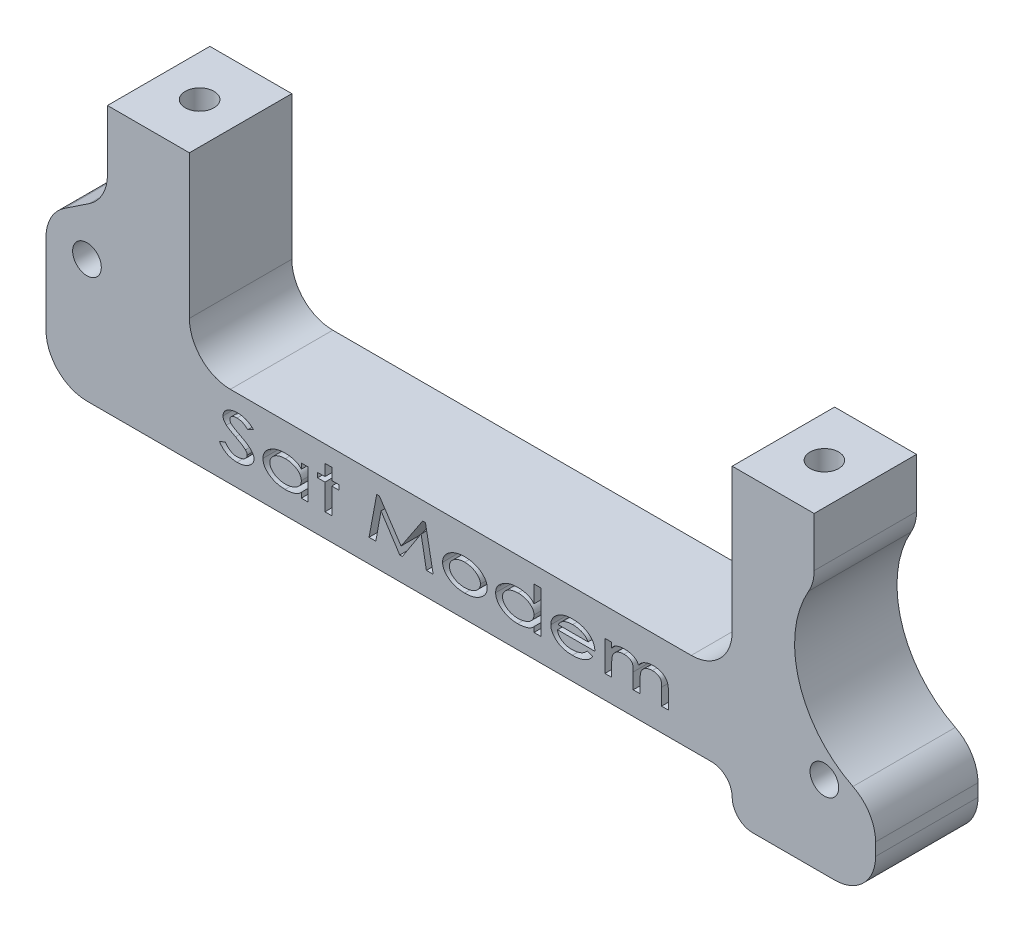
from build123d import *

# Parameters (mm, degrees)
SKETCH1_R           = 0.889
BOSS_EXTRUDE1_DEPTH = 6.35
SKETCH2_R           = 0.889
CUT_EXTRUDE1_DEPTH  = 5.08
SKETCH3_R           = 0.889
BOSS_EXTRUDE2_DEPTH = 6.35
SKETCH4_R           = 0.889
CUT_EXTRUDE2_DEPTH  = 5.08
FILLET1_R           = 2.54
CUT_EXTRUDE3_DEPTH  = 1.27
FILLET3_R           = 1.27


with BuildPart() as part:
    # Sketch1 → Boss-Extrude1 (new body)
    with BuildSketch(Plane.XY):
        Polygon((0, 0), (-2.54, 0), (-2.54, 6.35), (1.27, 8.89), (1.27, 13.97), (3.81, 13.97), (6.35, 13.97), (6.35, 8.89), (2.54, 6.35), (2.54, 0), align=None)
        with Locations((0, 5.08)):
            Circle(SKETCH1_R, mode=Mode.SUBTRACT)
    extrude(amount=BOSS_EXTRUDE1_DEPTH)

    # Sketch2 → Cut-Extrude1 (cut)
    with BuildSketch(Plane(origin=(0, 13.97, 0), x_dir=(1, 0, 0), z_dir=(0, 1, 0))):
        with Locations(Location((3.81, -3.175, 0), (0, 0, 270))):
            Circle(SKETCH2_R)
    extrude(amount=-CUT_EXTRUDE1_DEPTH, mode=Mode.SUBTRACT)


with BuildPart() as body_2:
    # Sketch3 → Boss-Extrude2 (new body)
    with BuildSketch(Plane.XY.offset(6.35)):
        with BuildLine():
            Line((45.085, 13.97), (42.545, 13.97))
            Line((42.545, 13.97), (40.005, 13.97))
            Line((40.005, 13.97), (40.005, 5.08))
            Line((40.005, 5.08), (40.005, 2.54))
            Line((40.005, 2.54), (6.35, 2.54))
            Line((6.35, 2.54), (6.35, 5.08))
            Line((6.35, 5.08), (6.35, 8.89))
            Line((6.35, 8.89), (2.54, 6.35))
            Line((2.54, 6.35), (2.54, 5.08))
            Line((2.54, 5.08), (2.54, 0))
            Line((2.54, 0), (-2.54, 0))
            Line((-2.54, 0), (-2.54, -2.54))
            Line((-2.54, -2.54), (6.35, -2.54))
            Line((6.35, -2.54), (40.005, -2.54))
            Line((40.005, -2.54), (40.005, -5.08))
            Line((40.005, -5.08), (48.895, -5.08))
            Line((48.895, -5.08), (48.895, 0))
            ThreePointArc((48.895, 0), (44.289046529, 4.067142448), (45.085, 10.16))
            Line((45.085, 10.16), (45.085, 13.97))
        make_face()
        with Locations((45.72, 0)):
            Circle(SKETCH3_R, mode=Mode.SUBTRACT)
    extrude(amount=-BOSS_EXTRUDE2_DEPTH)

    # Sketch4 → Cut-Extrude2 (cut)
    with BuildSketch(Plane(origin=(0, 13.97, 0), x_dir=(1, 0, 0), z_dir=(0, 1, 0))):
        with Locations(Location((42.545, -3.175, 0), (0, 0, 270))):
            Circle(SKETCH4_R)
    extrude(amount=-CUT_EXTRUDE2_DEPTH, mode=Mode.SUBTRACT)

    # Combine1: union part
    add(part.part)

    # Fillet1
    fillet1_edges = [body_2.edges().sort_by_distance(p)[0] for p in [
        (48.895, 0, 3.175),
        (48.895, -5.08, 3.175),
        (-2.54, -2.54, 3.175),
        (6.35, 2.54, 3.175),
        (40.005, 2.54, 3.175),
        (45.085, 10.16, 3.175),
        (1.27, 8.89, 3.175),
        (-2.54, 6.35, 3.175),
    ]]
    fillet(fillet1_edges, radius=FILLET1_R)

    # Sketch5 → Cut-Extrude3 (cut)
    # profile 1 of 8: a face of its own
    with BuildSketch(Plane.XY.offset(6.35)):
        with BuildLine():
            Line((8.209416158, -0.599815641), (8.567621286, -0.454294808))
            add(Edge.make_bspline(
                [(8.567621286, -0.454294808), (8.595567039, -0.487859205), (8.649616222, -0.552775268), (8.737047903, -0.639050416), (8.825692977, -0.712499887), (8.91612665, -0.772659085), (9.008141072, -0.819479637), (9.101742109, -0.853045199), (9.197129605, -0.873800405), (9.261543052, -0.876353571), (9.29369901, -0.877628141)],
                knots=[0, 0, 0, 0, 1.204403746, 2.329407229, 3.383292808, 4.376124273, 5.319920516, 6.224240073, 7.113519548, 8, 8, 8, 8], degree=3))
            add(Edge.make_bspline(
                [(9.29369901, -0.877628141), (9.322900058, -0.876940352), (9.380652933, -0.875580065), (9.465720726, -0.86488052), (9.547497432, -0.846248799), (9.625272418, -0.821774186), (9.696850751, -0.791341472), (9.759887128, -0.755716859), (9.81397442, -0.715901882), (9.857653154, -0.671039212), (9.892200407, -0.62354309), (9.917036201, -0.574478513), (9.932096917, -0.524026728), (9.934246575, -0.490007131), (9.935313594, -0.47312093)],
                knots=[0, 0, 0, 0, 1.261425992, 2.494806987, 3.696567175, 4.88079595, 6.013291718, 7.050351036, 8.00296582, 8.904613568, 9.744534866, 10.531037541, 11.270855683, 12, 12, 12, 12], degree=3))
            add(Edge.make_bspline(
                [(9.935313594, -0.47312093), (9.933882054, -0.453761952), (9.93093488, -0.413906753), (9.907528312, -0.355310371), (9.871325091, -0.29695813), (9.838643301, -0.261768729), (9.821339235, -0.243136955)],
                knots=[0, 0, 0, 0, 0.881099276, 1.813958736, 2.842554116, 4, 4, 4, 4], degree=3))
            add(Edge.make_bspline(
                [(9.821339235, -0.243136955), (9.806270012, -0.229004546), (9.774287548, -0.199010347), (9.71903107, -0.155986491), (9.655470909, -0.110551675), (9.583770125, -0.061870926), (9.502619723, -0.012400366), (9.412813335, 0.039565892), (9.314403385, 0.093820793), (9.245431177, 0.12995429), (9.209744683, 0.148649904)],
                knots=[0, 0, 0, 0, 0.680316442, 1.443883074, 2.30454259, 3.254539655, 4.298172233, 5.43481373, 6.672762469, 8, 8, 8, 8], degree=3))
            add(Edge.make_bspline(
                [(9.209744683, 0.148649904), (9.173380557, 0.167517035), (9.104142012, 0.203440699), (9.006315461, 0.256748467), (8.918663973, 0.304969669), (8.84248106, 0.350754779), (8.775922751, 0.39092624), (8.720804631, 0.428055236), (8.675592869, 0.460333326), (8.650588061, 0.482258018), (8.639364074, 0.492099423)],
                knots=[0, 0, 0, 0, 1.473809098, 2.806183083, 4.008098438, 5.072351146, 6.003750605, 6.804226864, 7.463249592, 8, 8, 8, 8], degree=3))
            add(Edge.make_bspline(
                [(8.639364074, 0.492099423), (8.623335961, 0.507281097), (8.592115721, 0.536852604), (8.550742408, 0.58425197), (8.515920592, 0.632875962), (8.487067297, 0.682290551), (8.464922579, 0.733215903), (8.449303096, 0.78514265), (8.43896059, 0.838023947), (8.437897512, 0.873662444), (8.437364876, 0.891518494)],
                knots=[0, 0, 0, 0, 1.147998132, 2.236119427, 3.266892629, 4.255099878, 5.207404002, 6.147987646, 7.072081361, 8, 8, 8, 8], degree=3))
            add(Edge.make_bspline(
                [(8.437364876, 0.891518494), (8.437829104, 0.905779173), (8.438743869, 0.933879938), (8.443840979, 0.975644321), (8.452821219, 1.016291467), (8.466599927, 1.055680027), (8.482517091, 1.094381562), (8.502770692, 1.131945599), (8.526538639, 1.168420825), (8.563898141, 1.215777825), (8.618187984, 1.271524775), (8.695253481, 1.329643611), (8.782725927, 1.38086547), (8.880968074, 1.422709622), (8.986272192, 1.457256184), (9.097445724, 1.481434733), (9.212547308, 1.496603889), (9.290768325, 1.498561273), (9.330333626, 1.499551346)],
                knots=[0, 0, 0, 0, 0.57284708, 1.128799077, 1.687373995, 2.240984074, 2.802706851, 3.366491003, 3.952194653, 4.549042111, 5.787026847, 7.064996091, 8.414386474, 9.84820421, 11.345348371, 12.859259147, 14.411368701, 16, 16, 16, 16], degree=3))
            add(Edge.make_bspline(
                [(9.330333626, 1.499551346), (9.374142679, 1.498655163), (9.460527006, 1.496888036), (9.587825197, 1.480421599), (9.710821863, 1.45474975), (9.81041113, 1.424139041), (9.888586912, 1.392931176), (9.948399546, 1.364742284), (10.009161573, 1.331708286), (10.071013933, 1.293887902), (10.13344473, 1.250954826), (10.19722283, 1.203597295), (10.261755051, 1.151141586), (10.304329598, 1.113677424), (10.326082824, 1.09453532)],
                knots=[0, 0, 0, 0, 1.428510824, 2.816790956, 4.179702888, 5.523684412, 6.208959093, 6.924242334, 7.679310206, 8.464038766, 9.288115338, 10.150117837, 11.054813087, 12, 12, 12, 12], degree=3))
            Line((10.326082824, 1.09453532), (9.978562792, 0.9133975))
            add(Edge.make_bspline(
                [(9.978562792, 0.9133975), (9.960343059, 0.928109095), (9.924967015, 0.95667362), (9.872097938, 0.996012998), (9.82226012, 1.031945601), (9.774750431, 1.063421968), (9.73039487, 1.091543665), (9.688185343, 1.115139163), (9.648863581, 1.135000999), (9.599682098, 1.156148566), (9.538309955, 1.176853458), (9.462429295, 1.193978284), (9.383370309, 1.204406439), (9.329687308, 1.205776639), (9.30234885, 1.206474423)],
                knots=[0, 0, 0, 0, 1.117257755, 2.169305093, 3.143926228, 4.048461068, 4.888268315, 5.649151633, 6.354886442, 6.989271394, 8.202308643, 9.439111444, 10.695848923, 12, 12, 12, 12], degree=3))
            add(Edge.make_bspline(
                [(9.30234885, 1.206474423), (9.271233936, 1.205618277), (9.21164713, 1.203978709), (9.126820037, 1.188265319), (9.050324381, 1.164018184), (8.994285554, 1.133567188), (8.955023576, 1.105673148), (8.929799145, 1.083243661), (8.908923126, 1.05908848), (8.891121888, 1.033885577), (8.877469426, 1.006972312), (8.867498844, 0.978431382), (8.861999976, 0.94837837), (8.861134784, 0.927834454), (8.860698209, 0.917468013)],
                knots=[0, 0, 0, 0, 1.910046694, 3.657846604, 5.282621723, 6.821391664, 7.55315207, 8.23949341, 8.889503724, 9.511069909, 10.130973799, 10.737415314, 11.362900893, 12, 12, 12, 12], degree=3))
            add(Edge.make_bspline(
                [(8.860698209, 0.917468013), (8.861320924, 0.90402447), (8.862563421, 0.877200714), (8.87150514, 0.837753995), (8.886120364, 0.799522124), (8.9061937, 0.761911779), (8.933163486, 0.724553622), (8.968443354, 0.68850388), (9.009656247, 0.650659175), (9.041396708, 0.627789404), (9.058118081, 0.61574125)],
                knots=[0, 0, 0, 0, 0.85853488, 1.713025381, 2.570396888, 3.467262073, 4.429683605, 5.502862464, 6.684468789, 8, 8, 8, 8], degree=3))
            add(Edge.make_bspline(
                [(9.058118081, 0.61574125), (9.066374102, 0.610225938), (9.085759614, 0.597275736), (9.120534124, 0.577572976), (9.163654085, 0.552296711), (9.216294463, 0.523523402), (9.277748279, 0.49005172), (9.348040413, 0.451566386), (9.427778304, 0.40969146), (9.483990074, 0.380319188), (9.513506703, 0.364895897)],
                knots=[0, 0, 0, 0, 0.458069209, 1.075567279, 1.843501004, 2.764907121, 3.843713047, 5.073065989, 6.463075867, 8, 8, 8, 8], degree=3))
            add(Edge.make_bspline(
                [(9.513506703, 0.364895897), (9.552425631, 0.344353068), (9.62760611, 0.304670071), (9.735069429, 0.244856018), (9.832697132, 0.186310797), (9.921058758, 0.130058672), (9.999392365, 0.075096212), (10.068523965, 0.022389105), (10.127705556, -0.029077492), (10.178267657, -0.078806915), (10.221102884, -0.127648548), (10.257394645, -0.176327151), (10.288461484, -0.224533741), (10.314589409, -0.272559086), (10.333548797, -0.321123692), (10.348399971, -0.369111817), (10.35657372, -0.41738299), (10.357958685, -0.449519071), (10.358646927, -0.465488718)],
                knots=[0, 0, 0, 0, 1.705047532, 3.29367472, 4.764359135, 6.115067738, 7.351092649, 8.470927793, 9.481641474, 10.387736264, 11.216704684, 11.996056616, 12.737939354, 13.437585149, 14.109943664, 14.754462843, 15.381044999, 16, 16, 16, 16], degree=3))
            add(Edge.make_bspline(
                [(10.358646927, -0.465488718), (10.35787293, -0.488472918), (10.356331391, -0.534249673), (10.340561179, -0.601465016), (10.316671854, -0.666789084), (10.282490712, -0.729803646), (10.238935864, -0.790660461), (10.185147156, -0.848843153), (10.122307789, -0.905386184), (10.050710607, -0.959029931), (9.972442745, -1.008689044), (9.888767894, -1.051902062), (9.800960382, -1.088625633), (9.708920178, -1.118762962), (9.612599964, -1.142018591), (9.512136269, -1.158892942), (9.407351322, -1.168476749), (9.336119235, -1.169952645), (9.29980478, -1.170705064)],
                knots=[0, 0, 0, 0, 0.788129436, 1.56968741, 2.358505394, 3.171618619, 4.02347347, 4.922347341, 5.887446626, 6.923145908, 7.991358753, 9.067357325, 10.153509495, 11.256909772, 12.389986101, 13.553512878, 14.752769255, 16, 16, 16, 16], degree=3))
            add(Edge.make_bspline(
                [(9.29980478, -1.170705064), (9.272828684, -1.170277076), (9.219497335, -1.16943095), (9.140509045, -1.163817655), (9.063384114, -1.154186916), (8.988195924, -1.140327599), (8.914717709, -1.123231698), (8.843458664, -1.10167689), (8.773918912, -1.076724564), (8.705922394, -1.047746172), (8.639366734, -1.013622728), (8.574313323, -0.972955665), (8.510533437, -0.926177222), (8.447514978, -0.873462912), (8.385915541, -0.814207784), (8.325682663, -0.748588486), (8.266195261, -0.676948734), (8.228663891, -0.62596324), (8.209416158, -0.599815641)],
                knots=[0, 0, 0, 0, 1.006227997, 1.989298091, 2.952128759, 3.903900811, 4.839962792, 5.764667717, 6.679210144, 7.594649299, 8.519895108, 9.466121111, 10.453132521, 11.468093358, 12.528547425, 13.63887556, 14.789111772, 16, 16, 16, 16], degree=3))
        make_face()
    # profile 2 of 8: a face of its own
    with BuildSketch(Plane.XY.offset(6.35)):
        with BuildLine():
            Line((13.712749491, 0.78314109), (13.712749491, -1.105576859))
            Line((13.712749491, -1.105576859), (13.289416158, -1.105576859))
            Line((13.289416158, -1.105576859), (13.289416158, -0.79062093))
            add(Edge.make_bspline(
                [(13.289416158, -0.79062093), (13.277775924, -0.804567439), (13.254140815, -0.832885364), (13.213847629, -0.872012593), (13.168781548, -0.90805885), (13.119473295, -0.941911514), (13.065798316, -0.97332508), (13.007485325, -1.00168046), (12.945041046, -1.027885399), (12.85529008, -1.058708587), (12.737046473, -1.091153832), (12.589289765, -1.118307695), (12.435498641, -1.134939398), (12.331022248, -1.137061716), (12.277893722, -1.138140962)],
                knots=[0, 0, 0, 0, 0.59286657, 1.203795929, 1.829971431, 2.475131726, 3.155190389, 3.858570061, 4.590852341, 5.364971803, 6.955662865, 8.589261133, 10.26556482, 12, 12, 12, 12], degree=3))
            add(Edge.make_bspline(
                [(12.277893722, -1.138140962), (12.231725872, -1.137270825), (12.14106234, -1.135562069), (12.007636114, -1.121810936), (11.879036998, -1.100571939), (11.755774071, -1.068460884), (11.637097687, -1.029133201), (11.523893552, -0.979930342), (11.415487013, -0.922381306), (11.313596041, -0.856207566), (11.220258912, -0.78392543), (11.137862656, -0.706760644), (11.068144874, -0.62516241), (11.011142964, -0.539249107), (10.966833864, -0.449284689), (10.934968553, -0.355290745), (10.915563576, -0.256995194), (10.913352784, -0.189968191), (10.912236671, -0.156129744)],
                knots=[0, 0, 0, 0, 1.190889276, 2.338645406, 3.457304184, 4.550467384, 5.621511307, 6.679894181, 7.731133741, 8.784665885, 9.810535541, 10.773237904, 11.6921299, 12.573246784, 13.426497455, 14.271992985, 15.127619154, 16, 16, 16, 16], degree=3))
            add(Edge.make_bspline(
                [(10.912236671, -0.156129744), (10.913291142, -0.122955064), (10.915380834, -0.057211384), (10.935735629, 0.039071083), (10.967345231, 0.131702151), (11.012094621, 0.220339896), (11.069891416, 0.30485223), (11.140104608, 0.385552093), (11.22336654, 0.462017848), (11.317843632, 0.533747851), (11.420581234, 0.599964956), (11.529999291, 0.657561003), (11.644219071, 0.706406211), (11.763213061, 0.746864246), (11.887286745, 0.777909431), (12.016436266, 0.799479815), (12.150399873, 0.813066318), (12.241395929, 0.81481701), (12.28756119, 0.815705192)],
                knots=[0, 0, 0, 0, 0.855543435, 1.69546699, 2.529157261, 3.377147248, 4.250438295, 5.166218617, 6.133042243, 7.163931696, 8.225603736, 9.285359399, 10.352571269, 11.42995896, 12.527100696, 13.650905647, 14.808227978, 16, 16, 16, 16], degree=3))
            add(Edge.make_bspline(
                [(12.28756119, 0.815705192), (12.342046986, 0.814480257), (12.448924253, 0.812077471), (12.605572369, 0.794766414), (12.754650572, 0.765211363), (12.873043904, 0.731085475), (12.9619788, 0.697638377), (13.023769402, 0.670469929), (13.080370889, 0.639657705), (13.132379187, 0.606936088), (13.179183353, 0.570944261), (13.2209275, 0.532309221), (13.258031588, 0.490961404), (13.279012136, 0.461109422), (13.289416158, 0.446306154)],
                knots=[0, 0, 0, 0, 1.771002469, 3.473931111, 5.115262809, 6.706398851, 7.472349499, 8.202876104, 8.898534536, 9.565369253, 10.198342074, 10.814746699, 11.412245988, 12, 12, 12, 12], degree=3))
            Line((13.289416158, 0.446306154), (13.289416158, 0.78314109))
            Line((13.289416158, 0.78314109), (13.712749491, 0.78314109))
        make_face()
        with BuildLine():
            add(Edge.make_bspline(
                [(12.297228658, 0.522628269), (12.254772046, 0.521561419), (12.171236132, 0.519462327), (12.048443642, 0.502610049), (11.930559133, 0.476036113), (11.818822987, 0.438008664), (11.715261233, 0.389928784), (11.620984441, 0.332914112), (11.537929931, 0.265703055), (11.477725716, 0.20226985), (11.436107484, 0.148161908), (11.409759297, 0.10651582), (11.386152958, 0.064808694), (11.368352983, 0.021325772), (11.353108107, -0.022330867), (11.343090154, -0.067066036), (11.336708413, -0.112524421), (11.335951263, -0.143218144), (11.335570004, -0.158673814)],
                knots=[0, 0, 0, 0, 1.564934391, 3.079101678, 4.561238672, 6.014800545, 7.422102438, 8.763849877, 10.066734671, 11.349609611, 11.978750407, 12.580698229, 13.165643647, 13.742916877, 14.310488493, 14.868750469, 15.430364981, 16, 16, 16, 16], degree=3))
            add(Edge.make_bspline(
                [(11.335570004, -0.158673814), (11.335971052, -0.174124206), (11.336767501, -0.204807447), (11.342863428, -0.250382101), (11.35398652, -0.294807921), (11.367976532, -0.338944594), (11.387141436, -0.382189943), (11.409962584, -0.424970323), (11.437095996, -0.466784406), (11.478815286, -0.521380258), (11.539444282, -0.584917231), (11.622678614, -0.652898448), (11.717139551, -0.710913615), (11.821233059, -0.759308038), (11.932773137, -0.797783897), (12.04972682, -0.825146125), (12.171069054, -0.841842396), (12.25341738, -0.843979744), (12.295193401, -0.845064038)],
                knots=[0, 0, 0, 0, 0.569555588, 1.131091788, 1.690709988, 2.256235529, 2.835895415, 3.431752916, 4.042259523, 4.671312591, 5.96284812, 7.269491954, 8.622933924, 10.038350804, 11.493739645, 12.964906207, 14.460270517, 16, 16, 16, 16], degree=3))
            add(Edge.make_bspline(
                [(12.295193401, -0.845064038), (12.339181748, -0.844062241), (12.426318464, -0.842077775), (12.555035693, -0.823975957), (12.680176619, -0.79582841), (12.780657543, -0.762212484), (12.857550913, -0.730298377), (12.911760059, -0.704539975), (12.962559863, -0.676869501), (13.009920863, -0.647488373), (13.053802154, -0.615892629), (13.094170596, -0.582289647), (13.130753926, -0.546596106), (13.164153439, -0.50937582), (13.1933688, -0.470409581), (13.219110145, -0.430317301), (13.241335185, -0.389215031), (13.258259462, -0.346306057), (13.272259057, -0.302670909), (13.282626768, -0.257968745), (13.288093613, -0.211897146), (13.288973036, -0.180904757), (13.289416158, -0.165288397)],
                knots=[0, 0, 0, 0, 1.979914931, 3.922022504, 5.841486324, 7.749504567, 8.68422631, 9.589528547, 10.4508153, 11.287922678, 12.097649616, 12.883874706, 13.650833179, 14.397364529, 15.133628248, 15.841248553, 16.541660313, 17.233777927, 17.914936497, 18.604182592, 19.296679368, 20, 20, 20, 20], degree=3))
            add(Edge.make_bspline(
                [(13.289416158, -0.165288397), (13.288515809, -0.141484341), (13.286739435, -0.094519294), (13.273207482, -0.02562085), (13.250448424, 0.040124547), (13.219134307, 0.103315282), (13.178703846, 0.163453922), (13.129091365, 0.220431407), (13.070647849, 0.274291099), (13.004427174, 0.32521078), (12.931716158, 0.371821718), (12.853511178, 0.411906903), (12.771329333, 0.446100459), (12.684897081, 0.474171582), (12.594037391, 0.495969978), (12.49883524, 0.511713989), (12.399344189, 0.520920095), (12.331677641, 0.522052011), (12.297228658, 0.522628269)],
                knots=[0, 0, 0, 0, 0.854754496, 1.686417822, 2.51108849, 3.347603022, 4.21280385, 5.106953924, 6.055399562, 7.063239889, 8.104380145, 9.153512213, 10.21600508, 11.29884717, 12.414564085, 13.569469511, 14.762618932, 16, 16, 16, 16], degree=3))
        make_face(mode=Mode.SUBTRACT)
    # profile 3 of 8: a face of its own
    with BuildSketch(Plane.XY.offset(6.35)):
        Polygon((14.754800773, 1.499551346), (15.178134106, 1.499551346), (15.178134106, 0.78314109), (15.634031542, 0.78314109), (15.634031542, 0.490064167), (15.178134106, 0.490064167), (15.178134106, -1.105576859), (14.754800773, -1.105576859), (14.754800773, 0.490064167), (14.298903337, 0.490064167), (14.298903337, 0.78314109), (14.754800773, 0.78314109), align=None)
    # profile 4 of 8: a face of its own
    with BuildSketch(Plane.XY.offset(6.35)):
        Polygon((17.490185389, -1.105576859), (17.963891318, 1.434423141), (18.127220645, 1.434423141), (19.473033946, -0.584551218), (20.817320805, 1.434423141), (20.986247087, 1.434423141), (21.463005901, -1.105576859), (21.043234267, -1.105576859), (20.718610869, 0.685448782), (19.554953017, -1.105576859), (19.393658946, -1.105576859), (18.23203635, 0.685448782), (17.909448209, -1.105576859), align=None)
    # profile 5 of 8: a face of its own
    with BuildSketch(Plane.XY.offset(6.35)):
        with BuildLine():
            add(Edge.make_bspline(
                [(23.417869683, 0.815705192), (23.468622165, 0.814963688), (23.567978542, 0.813512072), (23.713312881, 0.798115252), (23.851827974, 0.774579528), (23.983288764, 0.741150739), (24.107765199, 0.697747946), (24.225165176, 0.64452693), (24.336351035, 0.582552135), (24.404259835, 0.532681475), (24.438041959, 0.50787266)],
                knots=[0, 0, 0, 0, 1.121843398, 2.196193992, 3.227693111, 4.226424636, 5.19188842, 6.138536693, 7.073990655, 8, 8, 8, 8], degree=3))
            add(Edge.make_bspline(
                [(24.438041959, 0.50787266), (24.468206945, 0.483492156), (24.526650438, 0.436255874), (24.603976078, 0.358267163), (24.669552166, 0.277714919), (24.723616845, 0.194506575), (24.765385702, 0.1081713), (24.794954697, 0.019073647), (24.813550213, -0.072765037), (24.815918075, -0.135012486), (24.817108465, -0.166306026)],
                knots=[0, 0, 0, 0, 1.159598527, 2.246677282, 3.27838877, 4.26215131, 5.208447336, 6.139038675, 7.064442529, 8, 8, 8, 8], degree=3))
            add(Edge.make_bspline(
                [(24.817108465, -0.166306026), (24.815958823, -0.197942804), (24.813676944, -0.260737363), (24.794585269, -0.353174519), (24.763779019, -0.442597708), (24.720482616, -0.529184819), (24.664924437, -0.613023471), (24.597307821, -0.694159681), (24.517282497, -0.772078488), (24.426302553, -0.846289774), (24.325601164, -0.914547825), (24.216987663, -0.974935157), (24.100947005, -1.025180063), (23.978007499, -1.066442088), (23.848095535, -1.099156399), (23.710897092, -1.121552594), (23.56674134, -1.135699121), (23.468276566, -1.137314172), (23.417869683, -1.138140962)],
                knots=[0, 0, 0, 0, 0.806509271, 1.600807569, 2.397224564, 3.213850418, 4.063545236, 4.957743496, 5.903236688, 6.908841922, 7.949375341, 9.00302485, 10.074620494, 11.170669618, 12.308295498, 13.488453241, 14.714268703, 16, 16, 16, 16], degree=3))
            add(Edge.make_bspline(
                [(23.417869683, -1.138140962), (23.368817649, -1.13732045), (23.272888098, -1.135715802), (23.132500129, -1.121451948), (22.998892302, -1.099579155), (22.871980952, -1.067819347), (22.751649812, -1.027396256), (22.638253553, -0.977139841), (22.531308979, -0.918785524), (22.432824032, -0.851149915), (22.343184195, -0.77821775), (22.264882511, -0.700723588), (22.198454635, -0.619864089), (22.144168703, -0.535509128), (22.101329969, -0.448024379), (22.071062879, -0.357026998), (22.052732007, -0.262699881), (22.050356956, -0.198611489), (22.049159748, -0.166306026)],
                knots=[0, 0, 0, 0, 1.266731681, 2.477308061, 3.641211968, 4.761146019, 5.852858088, 6.915996234, 7.961090173, 8.995180484, 9.99760397, 10.942455291, 11.836067435, 12.695252235, 13.527993871, 14.345381971, 15.165945634, 16, 16, 16, 16], degree=3))
            add(Edge.make_bspline(
                [(22.049159748, -0.166306026), (22.050165061, -0.134336992), (22.052158751, -0.070937557), (22.070278207, 0.022186204), (22.098648836, 0.112081395), (22.139566381, 0.198160186), (22.191401718, 0.281038319), (22.254471037, 0.360734524), (22.329101845, 0.437097351), (22.38583109, 0.482832549), (22.414997087, 0.506346218)],
                knots=[0, 0, 0, 0, 0.964658345, 1.913063596, 2.854262027, 3.805222979, 4.783118644, 5.800724498, 6.869294597, 8, 8, 8, 8], degree=3))
            add(Edge.make_bspline(
                [(22.414997087, 0.506346218), (22.448785757, 0.531309668), (22.51627251, 0.581169639), (22.626536723, 0.643536754), (22.742442147, 0.697302549), (22.865316853, 0.74019609), (22.994111403, 0.774875678), (23.12973613, 0.797960925), (23.27164624, 0.813531294), (23.368470727, 0.81497078), (23.417869683, 0.815705192)],
                knots=[0, 0, 0, 0, 0.942172848, 1.881819717, 2.837402235, 3.806657492, 4.799314022, 5.827624345, 6.891674054, 8, 8, 8, 8], degree=3))
        make_face()
        with BuildLine():
            add(Edge.make_bspline(
                [(23.416852055, 0.522628269), (23.385284302, 0.522052743), (23.32319949, 0.520920847), (23.231666601, 0.511651768), (23.143582513, 0.495889625), (23.058694519, 0.47395624), (22.977027897, 0.445905301), (22.898525913, 0.411834096), (22.823250481, 0.371407957), (22.752267835, 0.325101603), (22.687172423, 0.274271681), (22.6295501, 0.22039847), (22.581231125, 0.162975289), (22.541743931, 0.102421028), (22.510308718, 0.039210157), (22.488188958, -0.027207215), (22.475295395, -0.096606869), (22.473436066, -0.143864891), (22.472493081, -0.167832468)],
                knots=[0, 0, 0, 0, 1.170638753, 2.302314259, 3.407901618, 4.486586774, 5.55086912, 6.607314778, 7.657090948, 8.716155278, 9.74675862, 10.716799497, 11.636587967, 12.522921502, 13.392215507, 14.247582655, 15.111236652, 16, 16, 16, 16], degree=3))
            add(Edge.make_bspline(
                [(22.472493081, -0.167832468), (22.472861693, -0.183629394), (22.473593775, -0.215002941), (22.480156875, -0.261402047), (22.489408044, -0.30704462), (22.504141534, -0.35125318), (22.521681177, -0.39494693), (22.544469846, -0.437004162), (22.570392329, -0.478494588), (22.610566021, -0.532105205), (22.669412747, -0.594227269), (22.750173288, -0.660252435), (22.841958158, -0.716694832), (22.943702057, -0.762812795), (23.053224752, -0.800118233), (23.169695213, -0.825397392), (23.29134147, -0.842591379), (23.374558773, -0.844230827), (23.416852055, -0.845064038)],
                knots=[0, 0, 0, 0, 0.588214266, 1.168225258, 1.743292835, 2.320820124, 2.90169103, 3.495311169, 4.100159398, 4.72321826, 5.988368824, 7.277283096, 8.599519126, 9.990627284, 11.431382809, 12.901562039, 14.425290069, 16, 16, 16, 16], degree=3))
            add(Edge.make_bspline(
                [(23.416852055, -0.845064038), (23.460998498, -0.843980097), (23.547733257, -0.841850471), (23.674862674, -0.825352317), (23.796205122, -0.797885008), (23.910748285, -0.759647352), (24.016478762, -0.710918529), (24.111822572, -0.653796668), (24.194976109, -0.586775064), (24.254244838, -0.523586487), (24.29524259, -0.470072689), (24.321351285, -0.428893464), (24.343750637, -0.387292548), (24.362476932, -0.344904378), (24.375904102, -0.301412499), (24.386292652, -0.257602999), (24.392621366, -0.212961909), (24.393388713, -0.182947219), (24.393775132, -0.167832468)],
                knots=[0, 0, 0, 0, 1.612918919, 3.16891064, 4.675481193, 6.153308641, 7.573175975, 8.922075574, 10.2046402, 11.463076354, 12.077928185, 12.665953787, 13.242733267, 13.803471536, 14.356240496, 14.903491756, 15.447822069, 16, 16, 16, 16], degree=3))
            add(Edge.make_bspline(
                [(24.393775132, -0.167832468), (24.392868932, -0.144538691), (24.391081218, -0.098585685), (24.377560295, -0.030785843), (24.354128697, 0.033900354), (24.323101241, 0.096901076), (24.281697184, 0.156454189), (24.231794002, 0.213821535), (24.173122959, 0.268903083), (24.105639576, 0.319928306), (24.032862481, 0.367368863), (23.955407759, 0.408892525), (23.874337365, 0.443929056), (23.789688506, 0.473095725), (23.701507525, 0.495439069), (23.609795077, 0.511035962), (23.514599562, 0.521085631), (23.449781223, 0.522108586), (23.416852055, 0.522628269)],
                knots=[0, 0, 0, 0, 0.847343288, 1.671604043, 2.503156942, 3.344975613, 4.219723447, 5.134153846, 6.107814097, 7.142248072, 8.208735868, 9.266275212, 10.335990339, 11.419204486, 12.520897708, 13.642073847, 14.802120714, 16, 16, 16, 16], degree=3))
        make_face(mode=Mode.SUBTRACT)
    # profile 6 of 8: a face of its own
    with BuildSketch(Plane.XY.offset(6.35)):
        with BuildLine():
            Line((28.138646927, 1.499551346), (28.138646927, -1.105576859))
            Line((28.138646927, -1.105576859), (27.715313594, -1.105576859))
            Line((27.715313594, -1.105576859), (27.715313594, -0.79062093))
            add(Edge.make_bspline(
                [(27.715313594, -0.79062093), (27.70367336, -0.804567439), (27.680038251, -0.832885364), (27.639745065, -0.872012593), (27.594678984, -0.90805885), (27.545370731, -0.941911514), (27.491695752, -0.97332508), (27.433382761, -1.00168046), (27.370938482, -1.027885399), (27.281187515, -1.058708587), (27.162943909, -1.091153832), (27.015187201, -1.118307695), (26.861396076, -1.134939398), (26.756919684, -1.137061716), (26.703791158, -1.138140962)],
                knots=[0, 0, 0, 0, 0.59286657, 1.203795929, 1.829971431, 2.475131726, 3.155190389, 3.858570061, 4.590852341, 5.364971803, 6.955662865, 8.589261133, 10.26556482, 12, 12, 12, 12], degree=3))
            add(Edge.make_bspline(
                [(26.703791158, -1.138140962), (26.657623308, -1.137270825), (26.566959776, -1.135562069), (26.43353355, -1.121810936), (26.304934434, -1.100571939), (26.181671506, -1.068460884), (26.062995123, -1.029133201), (25.949790988, -0.979930342), (25.841384449, -0.922381306), (25.739493477, -0.856207566), (25.646156348, -0.78392543), (25.563760092, -0.706760644), (25.49404231, -0.62516241), (25.4370404, -0.539249107), (25.3927313, -0.449284689), (25.360865989, -0.355290745), (25.341461012, -0.256995194), (25.33925022, -0.189968191), (25.338134106, -0.156129744)],
                knots=[0, 0, 0, 0, 1.190889276, 2.338645406, 3.457304184, 4.550467384, 5.621511307, 6.679894181, 7.731133741, 8.784665885, 9.810535541, 10.773237904, 11.6921299, 12.573246784, 13.426497455, 14.271992985, 15.127619154, 16, 16, 16, 16], degree=3))
            add(Edge.make_bspline(
                [(25.338134106, -0.156129744), (25.339188578, -0.122955064), (25.34127827, -0.057211384), (25.361633065, 0.039071083), (25.393242667, 0.131702151), (25.437992057, 0.220339896), (25.495788852, 0.30485223), (25.566002044, 0.385552093), (25.649263976, 0.462017848), (25.743741068, 0.533747851), (25.84647867, 0.599964956), (25.955896727, 0.657561003), (26.070116507, 0.706406211), (26.189110497, 0.746864246), (26.313184181, 0.777909431), (26.442333701, 0.799479815), (26.576297309, 0.813066318), (26.667293365, 0.81481701), (26.713458626, 0.815705192)],
                knots=[0, 0, 0, 0, 0.855543435, 1.69546699, 2.529157261, 3.377147248, 4.250438295, 5.166218617, 6.133042243, 7.163931696, 8.225603736, 9.285359399, 10.352571269, 11.42995896, 12.527100696, 13.650905647, 14.808227978, 16, 16, 16, 16], degree=3))
            add(Edge.make_bspline(
                [(26.713458626, 0.815705192), (26.741279245, 0.815410191), (26.79611095, 0.814828772), (26.877446258, 0.810265032), (26.956699775, 0.802040247), (27.034118834, 0.790910339), (27.109494378, 0.776644502), (27.183077664, 0.759410117), (27.254552992, 0.738603533), (27.323592966, 0.714647793), (27.389367708, 0.688671444), (27.450599464, 0.659677884), (27.506880147, 0.628040167), (27.558406795, 0.593870871), (27.605460178, 0.557573298), (27.646657378, 0.517879894), (27.684120963, 0.476697625), (27.70494691, 0.446554906), (27.715313594, 0.431550545)],
                knots=[0, 0, 0, 0, 1.199628482, 2.364349786, 3.511254124, 4.634502578, 5.736113865, 6.818227801, 7.892154874, 8.94452349, 9.968529763, 10.940136062, 11.863619079, 12.750042389, 13.604449348, 14.421805789, 15.21441074, 16, 16, 16, 16], degree=3))
            Line((27.715313594, 0.431550545), (27.715313594, 1.499551346))
            Line((27.715313594, 1.499551346), (28.138646927, 1.499551346))
        make_face()
        with BuildLine():
            add(Edge.make_bspline(
                [(26.723126094, 0.522628269), (26.680669482, 0.521561419), (26.597133568, 0.519462327), (26.474341078, 0.502610049), (26.356456568, 0.476036113), (26.244720423, 0.438008664), (26.141158668, 0.389928784), (26.046881877, 0.332914112), (25.963827367, 0.265703055), (25.903623152, 0.20226985), (25.86200492, 0.148161908), (25.835656733, 0.10651582), (25.812050394, 0.064808694), (25.794250419, 0.021325772), (25.779005543, -0.022330867), (25.76898759, -0.067066036), (25.762605849, -0.112524421), (25.761848699, -0.143218144), (25.76146744, -0.158673814)],
                knots=[0, 0, 0, 0, 1.564934391, 3.079101678, 4.561238672, 6.014800545, 7.422102438, 8.763849877, 10.066734671, 11.349609611, 11.978750407, 12.580698229, 13.165643647, 13.742916877, 14.310488493, 14.868750469, 15.430364981, 16, 16, 16, 16], degree=3))
            add(Edge.make_bspline(
                [(25.76146744, -0.158673814), (25.761868488, -0.174124206), (25.762664937, -0.204807447), (25.768760864, -0.250382101), (25.779883956, -0.294807921), (25.793873968, -0.338944594), (25.813038872, -0.382189943), (25.83586002, -0.424970323), (25.862993432, -0.466784406), (25.904712722, -0.521380258), (25.965341718, -0.584917231), (26.04857605, -0.652898448), (26.143036987, -0.710913615), (26.247130495, -0.759308038), (26.358670573, -0.797783897), (26.475624256, -0.825146125), (26.59696649, -0.841842396), (26.679314816, -0.843979744), (26.721090837, -0.845064038)],
                knots=[0, 0, 0, 0, 0.569555588, 1.131091788, 1.690709988, 2.256235529, 2.835895415, 3.431752916, 4.042259523, 4.671312591, 5.96284812, 7.269491954, 8.622933924, 10.038350804, 11.493739645, 12.964906207, 14.460270517, 16, 16, 16, 16], degree=3))
            add(Edge.make_bspline(
                [(26.721090837, -0.845064038), (26.765079184, -0.844062241), (26.852215899, -0.842077775), (26.980933129, -0.823975957), (27.106074055, -0.79582841), (27.206554979, -0.762212484), (27.283448349, -0.730298377), (27.337657495, -0.704539975), (27.388457299, -0.676869501), (27.435818299, -0.647488373), (27.479699589, -0.615892629), (27.520068032, -0.582289647), (27.556651361, -0.546596106), (27.590050875, -0.50937582), (27.619266236, -0.470409581), (27.645007581, -0.430317301), (27.667232621, -0.389215031), (27.684156897, -0.346306057), (27.698156493, -0.302670909), (27.708524204, -0.257968745), (27.713991049, -0.211897146), (27.714870472, -0.180904757), (27.715313594, -0.165288397)],
                knots=[0, 0, 0, 0, 1.979914931, 3.922022504, 5.841486324, 7.749504567, 8.68422631, 9.589528547, 10.4508153, 11.287922678, 12.097649616, 12.883874706, 13.650833179, 14.397364529, 15.133628248, 15.841248553, 16.541660313, 17.233777927, 17.914936497, 18.604182592, 19.296679368, 20, 20, 20, 20], degree=3))
            add(Edge.make_bspline(
                [(27.715313594, -0.165288397), (27.714413245, -0.141484341), (27.71263687, -0.094519294), (27.699104918, -0.02562085), (27.67634586, 0.040124547), (27.645031743, 0.103315282), (27.604601282, 0.163453922), (27.5549888, 0.220431407), (27.496545285, 0.274291099), (27.43032461, 0.32521078), (27.357613594, 0.371821718), (27.279408614, 0.411906903), (27.197226769, 0.446100459), (27.110794517, 0.474171582), (27.019934827, 0.495969978), (26.924732676, 0.511713989), (26.825241625, 0.520920095), (26.757575077, 0.522052011), (26.723126094, 0.522628269)],
                knots=[0, 0, 0, 0, 0.854754496, 1.686417822, 2.51108849, 3.347603022, 4.21280385, 5.106953924, 6.055399562, 7.063239889, 8.104380145, 9.153512213, 10.21600508, 11.29884717, 12.414564085, 13.569469511, 14.762618932, 16, 16, 16, 16], degree=3))
        make_face(mode=Mode.SUBTRACT)
    # profile 7 of 8: a face of its own
    with BuildSketch(Plane.XY.offset(6.35)):
        with BuildLine():
            Line((31.01141135, -0.454294808), (31.362493081, -0.581498333))
            add(Edge.make_bspline(
                [(31.362493081, -0.581498333), (31.338351767, -0.61422486), (31.291112574, -0.678263411), (31.211104352, -0.764016391), (31.126295339, -0.838938524), (31.035862576, -0.903077697), (30.93981256, -0.957500502), (30.838414037, -1.005099046), (30.730918359, -1.045785082), (30.617102565, -1.079237564), (30.496800079, -1.106002679), (30.369556286, -1.124195871), (30.235373341, -1.136530553), (30.143573475, -1.137595574), (30.096563594, -1.138140962)],
                knots=[0, 0, 0, 0, 1.015058707, 1.986244616, 2.922738079, 3.837214079, 4.74989276, 5.67657167, 6.632495209, 7.617669594, 8.637252886, 9.70783443, 10.826202739, 12, 12, 12, 12], degree=3))
            add(Edge.make_bspline(
                [(30.096563594, -1.138140962), (30.045820096, -1.137299333), (29.946852223, -1.135657857), (29.802454453, -1.121810113), (29.666478961, -1.098765901), (29.538973935, -1.065853435), (29.419536288, -1.025277177), (29.308741151, -0.974011488), (29.206635411, -0.913192974), (29.11338567, -0.844311864), (29.030268263, -0.769263813), (28.957915134, -0.690638032), (28.895276377, -0.61026504), (28.84555586, -0.526171876), (28.805286887, -0.440245608), (28.778288216, -0.351079847), (28.760428457, -0.259622341), (28.758392192, -0.19759794), (28.757364876, -0.166306026)],
                knots=[0, 0, 0, 0, 1.32528581, 2.584778805, 3.785119494, 4.924142723, 6.021207208, 7.075751103, 8.106813727, 9.120511157, 10.099215731, 11.027273512, 11.908965137, 12.755389468, 13.57414856, 14.381306304, 15.18335328, 16, 16, 16, 16], degree=3))
            add(Edge.make_bspline(
                [(28.757364876, -0.166306026), (28.758408185, -0.136910897), (28.760470975, -0.078791994), (28.775008228, 0.007211826), (28.799805096, 0.090320681), (28.83333555, 0.171506456), (28.877923909, 0.24946069), (28.930759821, 0.325776353), (28.994487815, 0.398690611), (29.042258011, 0.443974879), (29.06672385, 0.467167532)],
                knots=[0, 0, 0, 0, 0.970143883, 1.918130665, 2.869417901, 3.828040576, 4.810639584, 5.827905561, 6.887546708, 8, 8, 8, 8], degree=3))
            add(Edge.make_bspline(
                [(29.06672385, 0.467167532), (29.099902595, 0.495221434), (29.166157385, 0.551242401), (29.276295389, 0.622169457), (29.394444481, 0.681511753), (29.520128843, 0.731303742), (29.654128984, 0.769380915), (29.796186333, 0.7959537), (29.94623834, 0.812588954), (30.049029668, 0.814650052), (30.101651735, 0.815705192)],
                knots=[0, 0, 0, 0, 0.932510036, 1.862133623, 2.805454254, 3.768786681, 4.761591166, 5.792587741, 6.869957246, 8, 8, 8, 8], degree=3))
            add(Edge.make_bspline(
                [(30.101651735, 0.815705192), (30.157493509, 0.814674552), (30.266388573, 0.812664737), (30.425188049, 0.795768216), (30.574954501, 0.767341682), (30.715895872, 0.727849959), (30.847996787, 0.676797847), (30.971239716, 0.614597828), (31.085803213, 0.540970346), (31.154321703, 0.482551674), (31.188478658, 0.453429551)],
                knots=[0, 0, 0, 0, 1.142863297, 2.228657225, 3.264310021, 4.260059601, 5.220716015, 6.158522157, 7.082010203, 8, 8, 8, 8], degree=3))
            add(Edge.make_bspline(
                [(31.188478658, 0.453429551), (31.212406157, 0.430690135), (31.259415033, 0.386015412), (31.32018511, 0.311212529), (31.372344204, 0.232761842), (31.415785258, 0.149738265), (31.448452407, 0.061681219), (31.473317994, -0.030371374), (31.488021315, -0.127009863), (31.490819453, -0.192886291), (31.492240677, -0.22634609)],
                knots=[0, 0, 0, 0, 1.031613266, 2.02674666, 3.006689767, 3.974785861, 4.950252709, 5.938546617, 6.952951482, 8, 8, 8, 8], degree=3))
            Line((31.492240677, -0.22634609), (29.180698209, -0.22634609))
            add(Edge.make_bspline(
                [(29.180698209, -0.22634609), (29.181944215, -0.247629214), (29.184411571, -0.289774312), (29.198962137, -0.351179054), (29.219688397, -0.410524232), (29.249020843, -0.466922578), (29.285642744, -0.521113255), (29.330061967, -0.572304438), (29.382172282, -0.621083045), (29.441218774, -0.666705986), (29.505693956, -0.708782483), (29.574937126, -0.744815854), (29.647299393, -0.776015893), (29.723313192, -0.80163975), (29.803106493, -0.82059907), (29.886146081, -0.835153261), (29.972937355, -0.843090475), (30.031929621, -0.844398226), (30.061964235, -0.845064038)],
                knots=[0, 0, 0, 0, 0.860618259, 1.70420655, 2.541554557, 3.397349544, 4.266668827, 5.180927621, 6.131904375, 7.148481798, 8.194770696, 9.240902231, 10.300858762, 11.378769255, 12.479970994, 13.614270949, 14.785358604, 16, 16, 16, 16], degree=3))
            add(Edge.make_bspline(
                [(30.061964235, -0.845064038), (30.093190489, -0.844627675), (30.155242275, -0.843760547), (30.247475767, -0.835191842), (30.338195332, -0.822067045), (30.426558638, -0.803927978), (30.510821497, -0.781279525), (30.589199468, -0.754992038), (30.660741639, -0.725369915), (30.72810224, -0.692149979), (30.79401198, -0.649345279), (30.862649763, -0.595793345), (30.936376519, -0.529974206), (30.98539936, -0.480530247), (31.01141135, -0.454294808)],
                knots=[0, 0, 0, 0, 1.059758125, 2.105916533, 3.141613969, 4.170262213, 5.166047922, 6.101873803, 6.974347642, 7.793138359, 8.647588259, 9.636811195, 10.746069346, 12, 12, 12, 12], degree=3))
        make_face()
        with BuildLine():
            add(Edge.make_bspline(
                [(31.069416158, 0.066730833), (31.058230142, 0.087577266), (31.035672279, 0.129616451), (30.991749771, 0.187572133), (30.94202738, 0.24360484), (30.883310209, 0.29558003), (30.816165127, 0.34465228), (30.738083647, 0.38813412), (30.649717158, 0.427328391), (30.551999966, 0.460490122), (30.448107895, 0.488602277), (30.340197148, 0.508184459), (30.229807677, 0.520217025), (30.155446942, 0.521819739), (30.117933786, 0.522628269)],
                knots=[0, 0, 0, 0, 0.767213956, 1.547173527, 2.354521805, 3.197082456, 4.088390499, 5.050319822, 6.093324546, 7.223805373, 8.398196433, 9.585484806, 10.781936651, 12, 12, 12, 12], degree=3))
            add(Edge.make_bspline(
                [(30.117933786, 0.522628269), (30.088404573, 0.52216243), (30.030093818, 0.521242545), (29.944145342, 0.513268003), (29.860847305, 0.501229773), (29.780317907, 0.484138491), (29.702916075, 0.46101922), (29.628380863, 0.433348545), (29.556037495, 0.401685623), (29.510373989, 0.375813302), (29.487513113, 0.362860641)],
                knots=[0, 0, 0, 0, 1.07654308, 2.125828392, 3.144766619, 4.144282087, 5.124653268, 6.087367879, 7.042464096, 8, 8, 8, 8], degree=3))
            add(Edge.make_bspline(
                [(29.487513113, 0.362860641), (29.459197324, 0.344739366), (29.402620821, 0.308532063), (29.329510993, 0.238236947), (29.264318561, 0.158392283), (29.230842626, 0.097687863), (29.213771126, 0.066730833)],
                knots=[0, 0, 0, 0, 0.985046583, 1.96817727, 2.963844878, 4, 4, 4, 4], degree=3))
            Line((29.213771126, 0.066730833), (31.069416158, 0.066730833))
        make_face(mode=Mode.SUBTRACT)
    # profile 8 of 8: a face of its own
    with BuildSketch(Plane.XY.offset(6.35)):
        with BuildLine():
            Line((32.11146744, 0.78314109), (32.534800773, 0.78314109))
            Line((32.534800773, 0.78314109), (32.534800773, 0.466149904))
            add(Edge.make_bspline(
                [(32.534800773, 0.466149904), (32.542518521, 0.480041546), (32.557919618, 0.507762916), (32.585508844, 0.546509624), (32.617002701, 0.582140698), (32.650838905, 0.615873205), (32.688617618, 0.646686411), (32.729563401, 0.675019821), (32.774059765, 0.70058644), (32.805376399, 0.71518597), (32.821263113, 0.722592212)],
                knots=[0, 0, 0, 0, 0.972460708, 1.940587246, 2.904751638, 3.881361678, 4.862598139, 5.885163234, 6.927157757, 8, 8, 8, 8], degree=3))
            add(Edge.make_bspline(
                [(32.821263113, 0.722592212), (32.863247415, 0.737029324), (32.947647147, 0.7660518), (33.079643383, 0.793977678), (33.215716718, 0.812952375), (33.308129896, 0.814778725), (33.355009106, 0.815705192)],
                knots=[0, 0, 0, 0, 0.977458177, 1.96495364, 2.96766491, 4, 4, 4, 4], degree=3))
            add(Edge.make_bspline(
                [(33.355009106, 0.815705192), (33.388281808, 0.815040594), (33.454153024, 0.813724863), (33.551771042, 0.802608265), (33.646920388, 0.785085883), (33.738447484, 0.760011803), (33.824895018, 0.730127618), (33.903971675, 0.694617862), (33.974738415, 0.654289694), (34.037432058, 0.609578212), (34.091442056, 0.55952246), (34.136440431, 0.503864945), (34.172292652, 0.442506514), (34.187794873, 0.397935542), (34.195570004, 0.375580994)],
                knots=[0, 0, 0, 0, 1.184574035, 2.345145663, 3.494218693, 4.626791488, 5.721346331, 6.748572381, 7.70899155, 8.617549066, 9.485046959, 10.322678179, 11.158740066, 12, 12, 12, 12], degree=3))
            add(Edge.make_bspline(
                [(34.195570004, 0.375580994), (34.205956883, 0.392739236), (34.226696382, 0.426999126), (34.263328335, 0.475067136), (34.304020565, 0.520299252), (34.348795576, 0.562699029), (34.398139633, 0.601406774), (34.451220967, 0.637520048), (34.508188001, 0.671464625), (34.569663226, 0.700822517), (34.633444973, 0.727838984), (34.69892881, 0.751031401), (34.765441285, 0.771109048), (34.833229428, 0.787387739), (34.902208509, 0.799959864), (34.972308591, 0.809387263), (35.043524085, 0.814260427), (35.091415887, 0.815221675), (35.115505901, 0.815705192)],
                knots=[0, 0, 0, 0, 0.902798883, 1.802619934, 2.716722708, 3.640729239, 4.576001688, 5.537877199, 6.53088282, 7.559162888, 8.603293685, 9.649434253, 10.686162558, 11.731075392, 12.787317934, 13.842786833, 14.914902069, 16, 16, 16, 16], degree=3))
            add(Edge.make_bspline(
                [(35.115505901, 0.815705192), (35.139091362, 0.815467016), (35.185640976, 0.814996939), (35.254398466, 0.809617026), (35.321138636, 0.801588247), (35.385686106, 0.790434498), (35.448253524, 0.776206178), (35.508535608, 0.758412353), (35.567036453, 0.73747875), (35.623047082, 0.713189679), (35.676348228, 0.686269522), (35.726509234, 0.65735284), (35.772695418, 0.625805956), (35.815535373, 0.59213696), (35.853819538, 0.555362904), (35.889396798, 0.51711125), (35.921100871, 0.476372916), (35.948755253, 0.432450396), (35.973698726, 0.385228566), (35.994306006, 0.332899991), (36.012051271, 0.275739519), (36.02683549, 0.213548848), (36.037807685, 0.14601667), (36.045742817, 0.073495295), (36.051065395, -0.004085166), (36.051499896, -0.057410467), (36.05172385, -0.084895769)],
                knots=[0, 0, 0, 0, 1.138546133, 2.247099734, 3.327840122, 4.383341338, 5.408382928, 6.424158044, 7.416253254, 8.406589428, 9.369771946, 10.298175852, 11.199903902, 12.068293145, 12.925607277, 13.760169774, 14.589007461, 15.413667779, 16.263439411, 17.163678845, 18.124595909, 19.151500351, 20.247368358, 21.425712977, 22.673142832, 24, 24, 24, 24], degree=3))
            Line((36.05172385, -0.084895769), (36.05172385, -1.105576859))
            Line((36.05172385, -1.105576859), (35.628390517, -1.105576859))
            Line((35.628390517, -1.105576859), (35.628390517, -0.085913397))
            add(Edge.make_bspline(
                [(35.628390517, -0.085913397), (35.628183321, -0.063352515), (35.627787483, -0.020251125), (35.625139798, 0.041671548), (35.621471054, 0.097902763), (35.615140242, 0.148619385), (35.607996193, 0.193761474), (35.598239929, 0.233173944), (35.587275068, 0.266976671), (35.570341582, 0.304805009), (35.541507948, 0.345732027), (35.498576031, 0.389800397), (35.444947527, 0.428219233), (35.382156481, 0.461642026), (35.310958256, 0.488992301), (35.23222092, 0.508651295), (35.146387537, 0.520400555), (35.086881337, 0.521866749), (35.055974651, 0.522628269)],
                knots=[0, 0, 0, 0, 1.105425717, 2.111858247, 3.036720023, 3.865484674, 4.615553349, 5.274657653, 5.852822265, 6.354904965, 7.299969952, 8.287280738, 9.357759844, 10.517816046, 11.764838993, 13.085063193, 14.486022692, 16, 16, 16, 16], degree=3))
            add(Edge.make_bspline(
                [(35.055974651, 0.522628269), (35.02011153, 0.521644796), (34.949479263, 0.519707849), (34.845896279, 0.501584052), (34.746530356, 0.473345144), (34.653098786, 0.433346897), (34.567716874, 0.383974648), (34.492720977, 0.32563511), (34.43012465, 0.258163229), (34.38668025, 0.194807032), (34.358822589, 0.137184862), (34.341222895, 0.086437173), (34.326930624, 0.028590738), (34.313974601, -0.03619668), (34.304650046, -0.108280514), (34.298237532, -0.187580339), (34.294160574, -0.273963008), (34.29356943, -0.334040312), (34.293262312, -0.36525234)],
                knots=[0, 0, 0, 0, 1.27430257, 2.509733521, 3.727549716, 4.940787357, 6.113812788, 7.226246842, 8.305891587, 9.374785751, 9.943955858, 10.577256213, 11.280862644, 12.061519167, 12.925576023, 13.863687773, 14.890119356, 16, 16, 16, 16], degree=3))
            Line((34.293262312, -0.36525234), (34.293262312, -1.105576859))
            Line((34.293262312, -1.105576859), (33.869928978, -1.105576859))
            Line((33.869928978, -1.105576859), (33.869928978, -0.147479904))
            add(Edge.make_bspline(
                [(33.869928978, -0.147479904), (33.869719647, -0.122036305), (33.869319016, -0.073340814), (33.866693787, -0.003446507), (33.86300161, 0.059893366), (33.856771003, 0.116735852), (33.849387026, 0.166861478), (33.840419258, 0.210642669), (33.829411293, 0.247788804), (33.812572988, 0.288968032), (33.78379965, 0.333265661), (33.741098639, 0.381258529), (33.686545339, 0.421993866), (33.623560462, 0.458248007), (33.551601729, 0.487021206), (33.472281818, 0.507570297), (33.386139591, 0.520666646), (33.326395724, 0.521959308), (33.295477856, 0.522628269)],
                knots=[0, 0, 0, 0, 1.178579603, 2.255636566, 3.239708153, 4.11686085, 4.903531435, 5.586143207, 6.185146518, 6.695818955, 7.641866717, 8.615343697, 9.657211448, 10.779811417, 11.974671018, 13.23431064, 14.56873648, 16, 16, 16, 16], degree=3))
            add(Edge.make_bspline(
                [(33.295477856, 0.522628269), (33.260987309, 0.521525525), (33.192804061, 0.519345545), (33.092126455, 0.502746147), (32.995108876, 0.474488033), (32.902561709, 0.436065982), (32.816594251, 0.388758965), (32.741642271, 0.330366393), (32.676971145, 0.264351337), (32.63278057, 0.201232901), (32.604271955, 0.14467402), (32.585445111, 0.096672388), (32.569973451, 0.042937665), (32.556687571, -0.016159571), (32.546703523, -0.080933047), (32.539658316, -0.151416309), (32.535758199, -0.227489065), (32.535126576, -0.2801065), (32.534800773, -0.307247532)],
                knots=[0, 0, 0, 0, 1.283241462, 2.536798598, 3.785339735, 5.036112688, 6.259851503, 7.42520405, 8.559034837, 9.688411653, 10.275575128, 10.913224865, 11.60428019, 12.354653701, 13.166173221, 14.041717701, 14.989882278, 16, 16, 16, 16], degree=3))
            Line((32.534800773, -0.307247532), (32.534800773, -1.105576859))
            Line((32.534800773, -1.105576859), (32.11146744, -1.105576859))
            Line((32.11146744, -1.105576859), (32.11146744, 0.78314109))
        make_face()
    extrude(amount=-CUT_EXTRUDE3_DEPTH, mode=Mode.SUBTRACT)

    # Fillet3
    fillet3_edges = [body_2.edges().sort_by_distance(p)[0] for p in [
        (40.005, -5.08, 3.175),
        (40.005, -2.54, 3.175),
    ]]
    fillet(fillet3_edges, radius=FILLET3_R - 0.0001)  # a hair under: the kernel refuses the full size


solid = body_2.part
